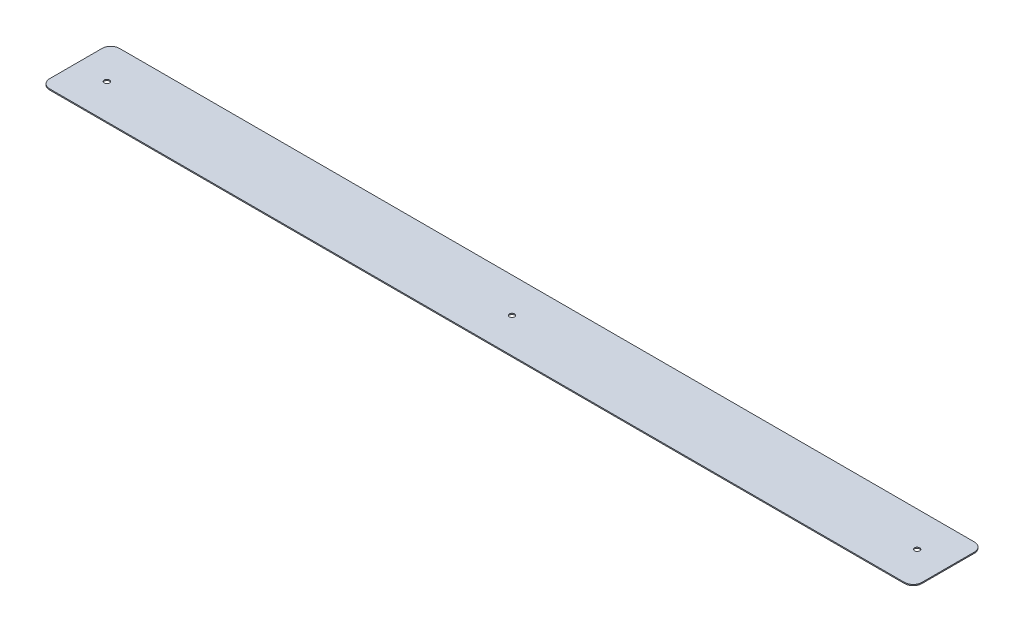
from build123d import *

# Parameters (mm, degrees)
SKETCH1_W             = 633.5522
SKETCH1_H             = 50.8
BOSS_EXTRUDE1_DEPTH   = 0.79375
FILLET1_R             = 6.35
F_6_CLEARANCE_HOLE1_D = 3.7973


with BuildPart() as part:
    # Sketch1 → Boss-Extrude1 (new body)
    with BuildSketch(Plane(origin=(0, 0, 0), x_dir=(1, 0, 0), z_dir=(0, 1, 0))):
        Rectangle(SKETCH1_W, SKETCH1_H)
    extrude(amount=BOSS_EXTRUDE1_DEPTH)

    # Fillet1
    fillet1_edges = [part.edges().sort_by_distance(p)[0] for p in [
        (-316.7761, 0.396875, -25.4),
        (-316.7761, 0.396875, 25.4),
        (316.7761, 0.396875, -25.4),
        (316.7761, 0.396875, 25.4),
    ]]
    fillet(fillet1_edges, radius=FILLET1_R)

    # #6 Clearance Hole1 (through all)
    with Locations(Plane(origin=(0, 0.79375, 0), x_dir=(1, 0, 0), z_dir=(0, 1, 0))):
        with Locations((294.256791216, 0), (0, 0), (-294.256791216, 0)):
            Hole(F_6_CLEARANCE_HOLE1_D / 2)


solid = part.part
